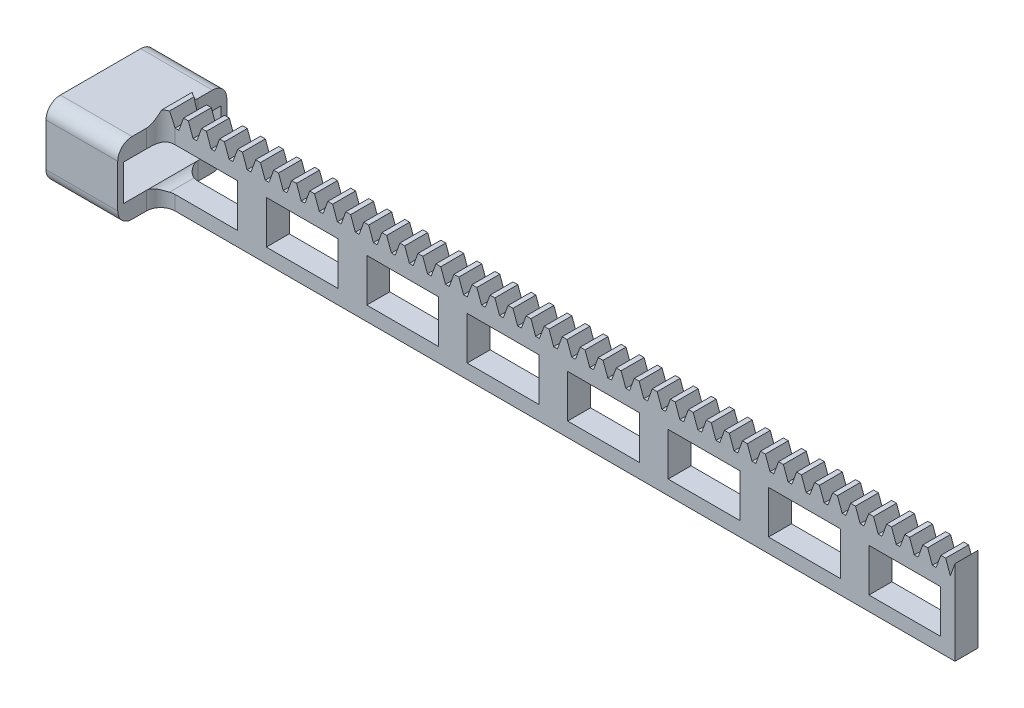
from build123d import *

# Parameters (mm, degrees)
SKETCH_1_W             = 125.663706144
SKETCH_1_H             = 10
EXTRUDE_1_DEPTH        = 30
EXTRUDE_2_DEPTH        = 30
PATTERN_LINEAR_1_COUNT = 20
PATTERN_LINEAR_1_PITCH = 6.283185307
CUT_EXTRUDE_1_DEPTH    = 22
CUT_EXTRUDE_2_REACH    = 128.315
CUT_EXTRUDE_3_REACH    = 246.059
CUT_EXTRUDE_6_REACH    = 484.653
SKETCH_7_W             = 207.345115137
SKETCH_7_H             = 14.578468588
CUT_EXTRUDE_7_REACH    = 552.426
SKETCH_9_W             = 278.972656916
SKETCH_9_H             = 19.040254303
SKETCH_10_W            = 8
SKETCH_10_H            = 15
EXTRUDE_1_2_DEPTH      = 276.776278088
SKETCH_11_W            = 38
SKETCH_11_H            = 25
SKETCH_11_R            = 1.25
EXTRUDE_2_2_DEPTH      = 25
CUT_EXTRUDE_9_REACH    = 280.853
SKETCH_12_W            = 25
SKETCH_12_H            = 15
CUT_EXTRUDE_10_REACH   = 280.853
SKETCH_13_W            = 1.776278088
SKETCH_13_H            = 15
SKETCH_14_W            = 34
SKETCH_14_H            = 12.5
CUT_EXTRUDE_11_DEPTH   = 20
CUT_EXTRUDE_12_REACH   = 305.682
SKETCH_15_W            = 23.5
SKETCH_15_H            = 12.5
FILLET_1_R             = 5
FILLET_2_R             = 5


with BuildPart() as part:
    # 草图1 → Extrude 1 (new body)
    with BuildSketch(Plane.XY):
        with Locations((62.831853072, -5)):
            Rectangle(SKETCH_1_W, SKETCH_1_H)
    extrude(amount=EXTRUDE_1_DEPTH)

    # 草图2 → Extrude 2 (add)
    with BuildSketch(Plane.XY.offset(30)):
        Polygon((0, 0), (1.637866054, 4.5), (3.323577771, 4.5), (4.961443825, 0), align=None)
    extrude_2 = extrude(amount=-EXTRUDE_2_DEPTH)

    # 阵列(线性)1: Extrude 2 ×20
    with Locations(*[(i * PATTERN_LINEAR_1_PITCH, 0, 0) for i in range(1, PATTERN_LINEAR_1_COUNT)]):
        add(extrude_2)

    # 草图3 → 切除-拉伸1 (cut)
    with BuildSketch(Plane.XY.offset(30)):
        Polygon((0, 0), (0, -10), (125.663706144, -10), (125.663706144, 0), (124.341964661, 0), (122.704098607, 4.5), (121.018386891, 4.5), (119.380520836, 0), (118.058779354, 0), (116.4209133, 4.5), (114.735201583, 4.5), (113.097335529, 0), (111.775594047, 0), (110.137727993, 4.5), (108.452016276, 4.5), (106.814150222, 0), (105.49240874, 0), (103.854542686, 4.5), (102.168830969, 4.5), (100.530964915, 0), (99.209223433, 0), (97.571357378, 4.5), (95.885645662, 4.5), (94.247779608, 0), (92.926038125, 0), (91.288172071, 4.5), (89.602460355, 4.5), (87.964594301, 0), (86.642852818, 0), (85.004986764, 4.5), (83.319275048, 4.5), (81.681408993, 0), (80.359667511, 0), (78.721801457, 4.5), (77.03608974, 4.5), (75.398223686, 0), (74.076482204, 0), (72.43861615, 4.5), (70.752904433, 4.5), (69.115038379, 0), (67.793296897, 0), (66.155430843, 4.5), (64.469719126, 4.5), (62.831853072, 0), (61.51011159, 0), (59.872245535, 4.5), (58.186533819, 4.5), (56.548667765, 0), (55.226926282, 0), (53.589060228, 4.5), (51.903348512, 4.5), (50.265482457, 0), (48.943740975, 0), (47.305874921, 4.5), (45.620163204, 4.5), (43.98229715, 0), (42.660555668, 0), (41.022689614, 4.5), (39.336977897, 4.5), (37.699111843, 0), (36.377370361, 0), (34.739504307, 4.5), (33.05379259, 4.5), (31.415926536, 0), (30.094185054, 0), (28.456318999, 4.5), (26.770607283, 4.5), (25.132741229, 0), (23.810999746, 0), (22.173133692, 4.5), (20.487421976, 4.5), (18.849555922, 0), (17.527814439, 0), (15.889948385, 4.5), (14.204236669, 4.5), (12.566370614, 0), (11.244629132, 0), (9.606763078, 4.5), (7.921051361, 4.5), (6.283185307, 0), (4.961443825, 0), (3.323577771, 4.5), (1.637866054, 4.5), align=None)
    extrude(amount=-CUT_EXTRUDE_1_DEPTH, mode=Mode.SUBTRACT)

    # 草图4 → 切除-拉伸2 (cut, up to next)
    with BuildSketch(Plane(origin=(0, 0, 0), x_dir=(-1, 0, 0), z_dir=(0, 0, -1)), mode=Mode.PRIVATE) as cut_extrude_2_sk1:
        Polygon((-121.861242749, 4.5), (-121.861242749, -10), (-125.663706144, -10), (-125.663706144, 0), (-124.341964661, 0), (-122.704098607, 4.5), align=None)
    cut_extrude_2_tool1 = extrude(cut_extrude_2_sk1.sketch, amount=-CUT_EXTRUDE_2_REACH, mode=Mode.PRIVATE) & part.part
    add(cut_extrude_2_tool1.solids().sort_by_distance((123.597626, -3.869254, 0))[0], mode=Mode.SUBTRACT)

    # 镜向1: part across plane


with BuildPart() as part_1:
    add(part.part)
    add(part.part.mirror(Plane(origin=(121.861242749, 4.5, 8.001025), x_dir=(0, 0, 1), z_dir=(-1, 0, 0))))

    # 草图5 → 切除-拉伸3 (cut, up to next)
    with BuildSketch(Plane(origin=(0, 0, 0), x_dir=(-1, 0, 0), z_dir=(0, 0, -1)), mode=Mode.PRIVATE) as cut_extrude_3_sk1:
        Polygon((-241.241763585, 4.5), (-241.241763585, -10), (-243.722485498, -10), (-243.722485498, 0), (-242.084619444, 4.5), align=None)
    cut_extrude_3_tool1 = extrude(cut_extrude_3_sk1.sketch, amount=-CUT_EXTRUDE_3_REACH, mode=Mode.PRIVATE) & part_1.part
    add(cut_extrude_3_tool1.solids().sort_by_distance((242.402862, -3.406333, 0))[0], mode=Mode.SUBTRACT)

    # 镜向2: part across plane


with BuildPart() as part_2:
    add(part_1.part)
    add(part_1.part.mirror(Plane(origin=(241.241763585, 4.5, 8.001025), x_dir=(0, 0, 1), z_dir=(-1, 0, 0))))

    # 草图7 → 切除-拉伸6 (cut, up to next)
    with BuildSketch(Plane(origin=(0, 0, 0), x_dir=(-1, 0, 0), z_dir=(0, 0, -1)), mode=Mode.PRIVATE) as cut_extrude_6_sk1:
        with Locations((-378.810969602, -2.710765706)):
            Rectangle(SKETCH_7_W, SKETCH_7_H)
    cut_extrude_6_tool1 = extrude(cut_extrude_6_sk1.sketch, amount=-CUT_EXTRUDE_6_REACH, mode=Mode.PRIVATE) & part_2.part
    add(cut_extrude_6_tool1.solids().sort_by_distance((378.81097, -2.710766, 0))[0], mode=Mode.SUBTRACT)

    # 镜向4: part across plane


with BuildPart() as part_3:
    add(part_2.part)
    add(part_2.part.mirror(Plane(origin=(275.138412034, 4.578468588, 8.001025), x_dir=(0, 0, 1), z_dir=(-1, 0, 0))))

    # 草图9 → 切除-拉伸7 (cut, up to next)
    with BuildSketch(Plane(origin=(0, 0, 0), x_dir=(-1, 0, 0), z_dir=(0, 0, -1)), mode=Mode.PRIVATE) as cut_extrude_7_sk1:
        with Locations((-416.262606546, -4.273704806)):
            Rectangle(SKETCH_9_W, SKETCH_9_H)
    cut_extrude_7_tool1 = extrude(cut_extrude_7_sk1.sketch, amount=-CUT_EXTRUDE_7_REACH, mode=Mode.PRIVATE) & part_3.part
    add(cut_extrude_7_tool1.solids().sort_by_distance((416.262607, -4.273705, 0))[0], mode=Mode.SUBTRACT)

    # 草图10 → Extrude 1 2 (add)
    with BuildSketch(Plane.ZY):
        with Locations((4, -17.5)):
            Rectangle(SKETCH_10_W, SKETCH_10_H)
    extrude(amount=-EXTRUDE_1_2_DEPTH)

    # 草图11 → Extrude 2 2 (add)
    with BuildSketch(Plane.ZY):
        with Locations((4, -12.5)):
            Rectangle(SKETCH_11_W, SKETCH_11_H)
        with Locations(Location((-10, -16, 0), (0, 0, 270))):
            Circle(SKETCH_11_R, mode=Mode.SUBTRACT)
        with Locations(Location((-10, -9, 0), (0, 0, 270))):
            Circle(SKETCH_11_R, mode=Mode.SUBTRACT)
        with Locations(Location((18, -9, 0), (0, 0, 270))):
            Circle(SKETCH_11_R, mode=Mode.SUBTRACT)
        with Locations(Location((18, -16, 0), (0, 0, 270))):
            Circle(SKETCH_11_R, mode=Mode.SUBTRACT)
    extrude(amount=EXTRUDE_2_2_DEPTH)

    # 草图12 → 切除-拉伸9 (cut, up to next)
    with BuildSketch(Plane(origin=(0, 0, 0), x_dir=(-1, 0, 0), z_dir=(0, 0, -1)), mode=Mode.PRIVATE) as cut_extrude_9_sk1:
        with Locations((-259.276278088, -12.5)):
            Rectangle(SKETCH_12_W, SKETCH_12_H)
    cut_extrude_9_tool1 = extrude(cut_extrude_9_sk1.sketch, amount=-CUT_EXTRUDE_9_REACH, mode=Mode.PRIVATE) & part_3.part
    # 草图12 → 切除-拉伸9 (cut, up to next)
    with BuildSketch(Plane(origin=(0, 0, 0), x_dir=(-1, 0, 0), z_dir=(0, 0, -1)), mode=Mode.PRIVATE) as cut_extrude_9_sk2:
        with Locations((-224.276278088, -12.5)):
            Rectangle(SKETCH_12_W, SKETCH_12_H)
    cut_extrude_9_tool2 = extrude(cut_extrude_9_sk2.sketch, amount=-CUT_EXTRUDE_9_REACH, mode=Mode.PRIVATE) & part_3.part
    # 草图12 → 切除-拉伸9 (cut, up to next)
    with BuildSketch(Plane(origin=(0, 0, 0), x_dir=(-1, 0, 0), z_dir=(0, 0, -1)), mode=Mode.PRIVATE) as cut_extrude_9_sk3:
        with Locations((-189.276278088, -12.5)):
            Rectangle(SKETCH_12_W, SKETCH_12_H)
    cut_extrude_9_tool3 = extrude(cut_extrude_9_sk3.sketch, amount=-CUT_EXTRUDE_9_REACH, mode=Mode.PRIVATE) & part_3.part
    # 草图12 → 切除-拉伸9 (cut, up to next)
    with BuildSketch(Plane(origin=(0, 0, 0), x_dir=(-1, 0, 0), z_dir=(0, 0, -1)), mode=Mode.PRIVATE) as cut_extrude_9_sk4:
        with Locations((-154.276278088, -12.5)):
            Rectangle(SKETCH_12_W, SKETCH_12_H)
    cut_extrude_9_tool4 = extrude(cut_extrude_9_sk4.sketch, amount=-CUT_EXTRUDE_9_REACH, mode=Mode.PRIVATE) & part_3.part
    # 草图12 → 切除-拉伸9 (cut, up to next)
    with BuildSketch(Plane(origin=(0, 0, 0), x_dir=(-1, 0, 0), z_dir=(0, 0, -1)), mode=Mode.PRIVATE) as cut_extrude_9_sk5:
        with Locations((-119.276278088, -12.5)):
            Rectangle(SKETCH_12_W, SKETCH_12_H)
    cut_extrude_9_tool5 = extrude(cut_extrude_9_sk5.sketch, amount=-CUT_EXTRUDE_9_REACH, mode=Mode.PRIVATE) & part_3.part
    # 草图12 → 切除-拉伸9 (cut, up to next)
    with BuildSketch(Plane(origin=(0, 0, 0), x_dir=(-1, 0, 0), z_dir=(0, 0, -1)), mode=Mode.PRIVATE) as cut_extrude_9_sk6:
        with Locations((-84.276278088, -12.5)):
            Rectangle(SKETCH_12_W, SKETCH_12_H)
    cut_extrude_9_tool6 = extrude(cut_extrude_9_sk6.sketch, amount=-CUT_EXTRUDE_9_REACH, mode=Mode.PRIVATE) & part_3.part
    # 草图12 → 切除-拉伸9 (cut, up to next)
    with BuildSketch(Plane(origin=(0, 0, 0), x_dir=(-1, 0, 0), z_dir=(0, 0, -1)), mode=Mode.PRIVATE) as cut_extrude_9_sk7:
        with Locations((-49.276278088, -12.5)):
            Rectangle(SKETCH_12_W, SKETCH_12_H)
    cut_extrude_9_tool7 = extrude(cut_extrude_9_sk7.sketch, amount=-CUT_EXTRUDE_9_REACH, mode=Mode.PRIVATE) & part_3.part
    # 草图12 → 切除-拉伸9 (cut, up to next)
    with BuildSketch(Plane(origin=(0, 0, 0), x_dir=(-1, 0, 0), z_dir=(0, 0, -1)), mode=Mode.PRIVATE) as cut_extrude_9_sk8:
        with Locations((-14.276278088, -12.5)):
            Rectangle(SKETCH_12_W, SKETCH_12_H)
    cut_extrude_9_tool8 = extrude(cut_extrude_9_sk8.sketch, amount=-CUT_EXTRUDE_9_REACH, mode=Mode.PRIVATE) & part_3.part
    add(cut_extrude_9_tool1.solids().sort_by_distance((259.276278, -12.5, 0))[0], mode=Mode.SUBTRACT)
    add(cut_extrude_9_tool2.solids().sort_by_distance((224.276278, -12.5, 0))[0], mode=Mode.SUBTRACT)
    add(cut_extrude_9_tool3.solids().sort_by_distance((189.276278, -12.5, 0))[0], mode=Mode.SUBTRACT)
    add(cut_extrude_9_tool4.solids().sort_by_distance((154.276278, -12.5, 0))[0], mode=Mode.SUBTRACT)
    add(cut_extrude_9_tool5.solids().sort_by_distance((119.276278, -12.5, 0))[0], mode=Mode.SUBTRACT)
    add(cut_extrude_9_tool6.solids().sort_by_distance((84.276278, -12.5, 0))[0], mode=Mode.SUBTRACT)
    add(cut_extrude_9_tool7.solids().sort_by_distance((49.276278, -12.5, 0))[0], mode=Mode.SUBTRACT)
    add(cut_extrude_9_tool8.solids().sort_by_distance((14.276278, -12.5, 0))[0], mode=Mode.SUBTRACT)

    # 草图13 → 切除-拉伸10 (cut, up to next)
    with BuildSketch(Plane(origin=(0, 0, 0), x_dir=(-1, 0, 0), z_dir=(0, 0, -1)), mode=Mode.PRIVATE) as cut_extrude_10_sk1:
        with Locations((-0.888139044, -12.5)):
            Rectangle(SKETCH_13_W, SKETCH_13_H)
    cut_extrude_10_tool1 = extrude(cut_extrude_10_sk1.sketch, amount=-CUT_EXTRUDE_10_REACH, mode=Mode.PRIVATE) & part_3.part
    add(cut_extrude_10_tool1.solids().sort_by_distance((0.888139, -12.5, 0))[0], mode=Mode.SUBTRACT)

    # 草图14 → 切除-拉伸11 (cut)
    with BuildSketch(Plane(origin=(0, 0, 0), x_dir=(0, 0, -1), z_dir=(1, 0, 0))):
        with Locations((-4, -12.5)):
            Rectangle(SKETCH_14_W, SKETCH_14_H)
    extrude(amount=-CUT_EXTRUDE_11_DEPTH, mode=Mode.SUBTRACT)

    # 草图15 → 切除-拉伸12 (cut, up to next)
    with BuildSketch(Plane.ZY.offset(25), mode=Mode.PRIVATE) as cut_extrude_12_sk1:
        with Locations((4, -12.5)):
            Rectangle(SKETCH_15_W, SKETCH_15_H)
    cut_extrude_12_tool1 = extrude(cut_extrude_12_sk1.sketch, amount=-CUT_EXTRUDE_12_REACH, mode=Mode.PRIVATE) & part_3.part
    add(cut_extrude_12_tool1.solids().sort_by_distance((-25, -12.5, 4))[0], mode=Mode.SUBTRACT)

    # 圆角1
    fillet_1_edges = [part_3.edges().sort_by_distance(p)[0] for p in [
        (-12.5, 0, -15),
        (-12.5, -25, -15),
        (-12.5, -25, 23),
        (-12.5, 0, 23),
    ]]
    fillet(fillet_1_edges, radius=FILLET_1_R)

    # 圆角2
    # the kernel refuses this fillet: 5 mm, written as the material it adds along each edge
    with BuildSketch(Plane(origin=(0, -25, 0), x_dir=(0, 0, -1), z_dir=(0, 1, 0)), Plane(origin=(0, -20, 8), x_dir=(0, 0, 1), z_dir=(0, -1, 0))) as fillet_2_piece_1:
        with BuildLine():
            CenterArc((FILLET_2_R, -FILLET_2_R), FILLET_2_R, 90, 90)
            Line((0, -FILLET_2_R), (-FILLET_2_R * 0.02, -FILLET_2_R))
            Line((-FILLET_2_R * 0.02, -FILLET_2_R), (-FILLET_2_R * 0.02, FILLET_2_R * 0.02))
            Line((-FILLET_2_R * 0.02, FILLET_2_R * 0.02), (FILLET_2_R, FILLET_2_R * 0.02))
            Line((FILLET_2_R, FILLET_2_R * 0.02), (FILLET_2_R, 0))
        make_face()
    extrude(amount=5)
    with BuildSketch(Plane(origin=(0, -20, 0), x_dir=(0, 1, 0), z_dir=(0, 0, 1))) as fillet_2_piece_2:
        with BuildLine():
            CenterArc((5, -3.307189139), FILLET_2_R, 138.590377891, 41.409622109)
            Line((0, -3.307189139), (-0.1, -3.307189139))
            Line((-0.1, -3.307189139), (-0.1, 0))
            Line((-0.1, 0), (0, 0.1))
            ThreePointArc((0, 0.1), (0.625, 0.1), (1.175, 0.066143783))
            Line((1.175, 0.066143783), (1.25, 0))
        make_face()
    extrude(amount=8)
    with BuildSketch(Plane(origin=(0, -5, 0), x_dir=(0, 0, -1), z_dir=(0, 1, 0))) as fillet_2_piece_3_section:
        with BuildLine():
            CenterArc((FILLET_2_R, -FILLET_2_R), FILLET_2_R, 90, 90)
            Line((0, -FILLET_2_R), (-FILLET_2_R * 0.02, -FILLET_2_R))
            Line((-FILLET_2_R * 0.02, -FILLET_2_R), (-FILLET_2_R * 0.02, FILLET_2_R * 0.02))
            Line((-FILLET_2_R * 0.02, FILLET_2_R * 0.02), (FILLET_2_R, FILLET_2_R * 0.02))
            Line((FILLET_2_R, FILLET_2_R * 0.02), (FILLET_2_R, 0))
        make_face()
    fillet_2_piece_3 = extrude(amount=5, mode=Mode.PRIVATE)
    fillet_2_piece_3 = split(fillet_2_piece_3, bisect_by=Plane(origin=(-0.672472736, -1.847603657, -1.129079789), z_dir=(0.9396926207859086, -0.3420201433256681, 0)), keep=Keep.TOP, mode=Mode.PRIVATE)
    add(fillet_2_piece_3)
    with BuildSketch(Plane(origin=(0, -5, 0), x_dir=(0, 0, -1), z_dir=(0, 1, 0))) as fillet_2_piece_4_section:
        with BuildLine():
            CenterArc((FILLET_2_R, -FILLET_2_R), FILLET_2_R, 90, 90)
            Line((0, -FILLET_2_R), (-FILLET_2_R * 0.02, -FILLET_2_R))
            Line((-FILLET_2_R * 0.02, -FILLET_2_R), (-FILLET_2_R * 0.02, FILLET_2_R * 0.02))
            Line((-FILLET_2_R * 0.02, FILLET_2_R * 0.02), (FILLET_2_R, FILLET_2_R * 0.02))
            Line((FILLET_2_R, FILLET_2_R * 0.02), (FILLET_2_R, 0))
        make_face()
    fillet_2_piece_4 = extrude(amount=5, mode=Mode.PRIVATE)
    fillet_2_piece_4 = split(fillet_2_piece_4, bisect_by=Plane(origin=(4.975797866, -0.039437404, 0.049987607), z_dir=(0.9396926207859082, 0.3420201433256694, 0)), keep=Keep.TOP, mode=Mode.PRIVATE)
    add(fillet_2_piece_4)
    with BuildSketch(Plane(origin=(0, -5, 0), x_dir=(0, 0, -1), z_dir=(0, 1, 0))) as fillet_2_piece_5_section:
        with BuildLine():
            CenterArc((FILLET_2_R, -FILLET_2_R), FILLET_2_R, 90, 90)
            Line((0, -FILLET_2_R), (-FILLET_2_R * 0.02, -FILLET_2_R))
            Line((-FILLET_2_R * 0.02, -FILLET_2_R), (-FILLET_2_R * 0.02, FILLET_2_R * 0.02))
            Line((-FILLET_2_R * 0.02, FILLET_2_R * 0.02), (FILLET_2_R, FILLET_2_R * 0.02))
            Line((FILLET_2_R, FILLET_2_R * 0.02), (FILLET_2_R, 0))
        make_face()
    fillet_2_piece_5 = extrude(amount=17.5, mode=Mode.PRIVATE)
    fillet_2_piece_5 = split(fillet_2_piece_5, bisect_by=Plane(origin=(1.714960856, 0, -0.674876137), z_dir=(0, 1, 0)), keep=Keep.TOP, mode=Mode.PRIVATE)
    fillet_2_piece_5 = split(fillet_2_piece_5, bisect_by=Plane(origin=(0.764024617, 2.099140384, -0.674876137), z_dir=(0.9396926207859086, -0.3420201433256681, 0)), keep=Keep.TOP, mode=Mode.PRIVATE)
    fillet_2_piece_5 = split(fillet_2_piece_5, bisect_by=Plane(origin=(1.714960856, 4.5, -0.674876137), z_dir=(0, -1, 0)), keep=Keep.TOP, mode=Mode.PRIVATE)
    fillet_2_piece_5 = split(fillet_2_piece_5, bisect_by=Plane(origin=(4.018265153, 2.591362103, -0.674876137), z_dir=(-0.9396926207859082, -0.3420201433256694, 0)), keep=Keep.TOP, mode=Mode.PRIVATE)
    add(fillet_2_piece_5)
    with BuildSketch(Plane(origin=(0, -5, 0), x_dir=(0, 0, -1), z_dir=(0, 1, 0))) as fillet_2_piece_6_section:
        with BuildLine():
            CenterArc((FILLET_2_R, -FILLET_2_R), FILLET_2_R, 90, 90)
            Line((0, -FILLET_2_R), (-FILLET_2_R * 0.02, -FILLET_2_R))
            Line((-FILLET_2_R * 0.02, -FILLET_2_R), (-FILLET_2_R * 0.02, FILLET_2_R * 0.02))
            Line((-FILLET_2_R * 0.02, FILLET_2_R * 0.02), (FILLET_2_R, FILLET_2_R * 0.02))
            Line((FILLET_2_R, FILLET_2_R * 0.02), (FILLET_2_R, 0))
        make_face()
    fillet_2_piece_6 = extrude(amount=5, mode=Mode.PRIVATE)
    fillet_2_piece_6 = split(fillet_2_piece_6, bisect_by=Plane(origin=(-0.037232593, -0.102295707, -2.45), z_dir=(-0.9396926207859086, 0.3420201433256681, 0)), keep=Keep.TOP, mode=Mode.PRIVATE)
    add(fillet_2_piece_6)
    with BuildSketch(Plane(origin=(0, 12.5, 8), x_dir=(0, 0, 1), z_dir=(0, -1, 0))) as fillet_2_piece_7_section:
        with BuildLine():
            CenterArc((FILLET_2_R, -FILLET_2_R), FILLET_2_R, 90, 90)
            Line((0, -FILLET_2_R), (-FILLET_2_R * 0.02, -FILLET_2_R))
            Line((-FILLET_2_R * 0.02, -FILLET_2_R), (-FILLET_2_R * 0.02, FILLET_2_R * 0.02))
            Line((-FILLET_2_R * 0.02, FILLET_2_R * 0.02), (FILLET_2_R, FILLET_2_R * 0.02))
            Line((FILLET_2_R, FILLET_2_R * 0.02), (FILLET_2_R, 0))
        make_face()
    fillet_2_piece_7 = extrude(amount=17.5, mode=Mode.PRIVATE)
    fillet_2_piece_7 = split(fillet_2_piece_7, bisect_by=Plane(origin=(1.714960856, 0, 8.674876137), z_dir=(0, 1, 0)), keep=Keep.TOP, mode=Mode.PRIVATE)
    fillet_2_piece_7 = split(fillet_2_piece_7, bisect_by=Plane(origin=(0.764024617, 2.099140384, 8.674876137), z_dir=(0.9396926207859086, -0.3420201433256681, 0)), keep=Keep.TOP, mode=Mode.PRIVATE)
    fillet_2_piece_7 = split(fillet_2_piece_7, bisect_by=Plane(origin=(4.018265153, 2.591362103, 8.674876137), z_dir=(-0.9396926207859082, -0.3420201433256694, 0)), keep=Keep.TOP, mode=Mode.PRIVATE)
    fillet_2_piece_7 = split(fillet_2_piece_7, bisect_by=Plane(origin=(1.714960856, 4.5, 8.674876137), z_dir=(0, -1, 0)), keep=Keep.TOP, mode=Mode.PRIVATE)
    add(fillet_2_piece_7)
    with BuildSketch(Plane(origin=(0, 0, 8), x_dir=(0, 0, 1), z_dir=(0, -1, 0))) as fillet_2_piece_8_section:
        with BuildLine():
            CenterArc((FILLET_2_R, -FILLET_2_R), FILLET_2_R, 90, 90)
            Line((0, -FILLET_2_R), (-FILLET_2_R * 0.02, -FILLET_2_R))
            Line((-FILLET_2_R * 0.02, -FILLET_2_R), (-FILLET_2_R * 0.02, FILLET_2_R * 0.02))
            Line((-FILLET_2_R * 0.02, FILLET_2_R * 0.02), (FILLET_2_R, FILLET_2_R * 0.02))
            Line((FILLET_2_R, FILLET_2_R * 0.02), (FILLET_2_R, 0))
        make_face()
    fillet_2_piece_8 = extrude(amount=5, mode=Mode.PRIVATE)
    fillet_2_piece_8 = split(fillet_2_piece_8, bisect_by=Plane(origin=(-0.672472736, -1.847603657, 9.129079789), z_dir=(0.9396926207859086, -0.3420201433256681, 0)), keep=Keep.TOP, mode=Mode.PRIVATE)
    add(fillet_2_piece_8)
    with BuildSketch(Plane(origin=(0, 0, 8), x_dir=(0, 0, 1), z_dir=(0, -1, 0))) as fillet_2_piece_9_section:
        with BuildLine():
            CenterArc((FILLET_2_R, -FILLET_2_R), FILLET_2_R, 90, 90)
            Line((0, -FILLET_2_R), (-FILLET_2_R * 0.02, -FILLET_2_R))
            Line((-FILLET_2_R * 0.02, -FILLET_2_R), (-FILLET_2_R * 0.02, FILLET_2_R * 0.02))
            Line((-FILLET_2_R * 0.02, FILLET_2_R * 0.02), (FILLET_2_R, FILLET_2_R * 0.02))
            Line((FILLET_2_R, FILLET_2_R * 0.02), (FILLET_2_R, 0))
        make_face()
    fillet_2_piece_9 = extrude(amount=5, mode=Mode.PRIVATE)
    fillet_2_piece_9 = split(fillet_2_piece_9, bisect_by=Plane(origin=(-0.037232593, -0.102295707, 10.45), z_dir=(-0.9396926207859086, 0.3420201433256681, 0)), keep=Keep.TOP, mode=Mode.PRIVATE)
    add(fillet_2_piece_9)
    with BuildSketch(Plane(origin=(0, 0, 8), x_dir=(0, 0, 1), z_dir=(0, -1, 0))) as fillet_2_piece_10_section:
        with BuildLine():
            CenterArc((FILLET_2_R, -FILLET_2_R), FILLET_2_R, 90, 90)
            Line((0, -FILLET_2_R), (-FILLET_2_R * 0.02, -FILLET_2_R))
            Line((-FILLET_2_R * 0.02, -FILLET_2_R), (-FILLET_2_R * 0.02, FILLET_2_R * 0.02))
            Line((-FILLET_2_R * 0.02, FILLET_2_R * 0.02), (FILLET_2_R, FILLET_2_R * 0.02))
            Line((FILLET_2_R, FILLET_2_R * 0.02), (FILLET_2_R, 0))
        make_face()
    fillet_2_piece_10 = extrude(amount=5, mode=Mode.PRIVATE)
    fillet_2_piece_10 = split(fillet_2_piece_10, bisect_by=Plane(origin=(4.975797866, -0.039437404, 7.950012393), z_dir=(0.9396926207859082, 0.3420201433256694, 0)), keep=Keep.TOP, mode=Mode.PRIVATE)
    add(fillet_2_piece_10)
    with BuildSketch(Plane(origin=(0, -5, 0), x_dir=(0, -1, 0), z_dir=(0, 0, 1))) as fillet_2_piece_11:
        with BuildLine():
            CenterArc((5, 3.307189139), FILLET_2_R, 180, 41.409622109)
            Line((0, 3.307189139), (-0.1, 3.307189139))
            Line((-0.1, 3.307189139), (-0.1, 0))
            Line((-0.1, 0), (0, -0.1))
            ThreePointArc((0, -0.1), (0.625, -0.1), (1.175, -0.066143783))
            Line((1.175, -0.066143783), (1.25, 0))
        make_face()
    extrude(amount=8)
    with BuildSketch(Plane(origin=(0, -25, 0), x_dir=(0, 0, -1), z_dir=(0, 1, 0))) as fillet_2_piece_12a_section:
        with BuildLine():
            CenterArc((FILLET_2_R, -FILLET_2_R), FILLET_2_R, 90, 90)
            Line((0, -FILLET_2_R), (-FILLET_2_R * 0.02, -FILLET_2_R))
            Line((-FILLET_2_R * 0.02, -FILLET_2_R), (-FILLET_2_R * 0.02, FILLET_2_R * 0.02))
            Line((-FILLET_2_R * 0.02, FILLET_2_R * 0.02), (FILLET_2_R, FILLET_2_R * 0.02))
            Line((FILLET_2_R, FILLET_2_R * 0.02), (FILLET_2_R, 0))
        make_face()
    fillet_2_piece_12a = extrude(amount=17.5, mode=Mode.PRIVATE)
    fillet_2_piece_12a = split(fillet_2_piece_12a, bisect_by=Plane(origin=(1.131975571, -18.75, -1.131975571), z_dir=(0, -1, 0)), keep=Keep.TOP, mode=Mode.PRIVATE)
    fillet_2_piece_12a = split(fillet_2_piece_12a, bisect_by=Plane(origin=(1.131975571, -20, -1.131975571), z_dir=(0, 1, 0)), keep=Keep.TOP, mode=Mode.PRIVATE)
    with BuildSketch(Plane(origin=(0, -20, -8.267972847), x_dir=(0, 1, 0), z_dir=(0, 0, 1))) as fillet_2_piece_12b_section:
        with BuildLine():
            CenterArc((5, -3.307189139), FILLET_2_R, 138.590377891, 41.409622109)
            Line((0, -3.307189139), (-0.1, -3.307189139))
            Line((-0.1, -3.307189139), (-0.1, 0))
            Line((-0.1, 0), (0, 0.1))
            ThreePointArc((0, 0.1), (0.625, 0.1), (1.175, 0.066143783))
            Line((1.175, 0.066143783), (1.25, 0))
        make_face()
    fillet_2_piece_12b = extrude(amount=16.267972847, mode=Mode.PRIVATE)
    fillet_2_piece_12b = split(fillet_2_piece_12b, bisect_by=Plane(origin=(0.907037832, -19.701125048, 0), z_dir=(0, 0, -1)), keep=Keep.TOP, mode=Mode.PRIVATE)
    fillet_2_piece_12 = fillet_2_piece_12a & fillet_2_piece_12b
    add(fillet_2_piece_12)
    with BuildSketch(Plane(origin=(0, -20, 0), x_dir=(0, 1, 0), z_dir=(0, 0, 1))) as fillet_2_piece_13a_section:
        with BuildLine():
            CenterArc((5, -3.307189139), FILLET_2_R, 138.590377891, 41.409622109)
            Line((0, -3.307189139), (-0.1, -3.307189139))
            Line((-0.1, -3.307189139), (-0.1, 0))
            Line((-0.1, 0), (0, 0.1))
            ThreePointArc((0, 0.1), (0.625, 0.1), (1.175, 0.066143783))
            Line((1.175, 0.066143783), (1.25, 0))
        make_face()
    fillet_2_piece_13a = extrude(amount=16.267972847, mode=Mode.PRIVATE)
    fillet_2_piece_13a = split(fillet_2_piece_13a, bisect_by=Plane(origin=(0.907037832, -19.701125048, 8), z_dir=(0, 0, 1)), keep=Keep.TOP, mode=Mode.PRIVATE)
    with BuildSketch(Plane(origin=(0, -7.5, 8), x_dir=(0, 0, 1), z_dir=(0, -1, 0))) as fillet_2_piece_13b_section:
        with BuildLine():
            CenterArc((FILLET_2_R, -FILLET_2_R), FILLET_2_R, 90, 90)
            Line((0, -FILLET_2_R), (-FILLET_2_R * 0.02, -FILLET_2_R))
            Line((-FILLET_2_R * 0.02, -FILLET_2_R), (-FILLET_2_R * 0.02, FILLET_2_R * 0.02))
            Line((-FILLET_2_R * 0.02, FILLET_2_R * 0.02), (FILLET_2_R, FILLET_2_R * 0.02))
            Line((FILLET_2_R, FILLET_2_R * 0.02), (FILLET_2_R, 0))
        make_face()
    fillet_2_piece_13b = extrude(amount=17.5, mode=Mode.PRIVATE)
    fillet_2_piece_13b = split(fillet_2_piece_13b, bisect_by=Plane(origin=(1.131975571, -18.75, 9.131975571), z_dir=(0, -1, 0)), keep=Keep.TOP, mode=Mode.PRIVATE)
    fillet_2_piece_13b = split(fillet_2_piece_13b, bisect_by=Plane(origin=(1.131975571, -20, 9.131975571), z_dir=(0, 1, 0)), keep=Keep.TOP, mode=Mode.PRIVATE)
    fillet_2_piece_13 = fillet_2_piece_13a & fillet_2_piece_13b
    add(fillet_2_piece_13)
    with BuildSketch(Plane(origin=(0, -17.5, 0), x_dir=(0, 0, -1), z_dir=(0, 1, 0))) as fillet_2_piece_14a_section:
        with BuildLine():
            CenterArc((FILLET_2_R, -FILLET_2_R), FILLET_2_R, 90, 90)
            Line((0, -FILLET_2_R), (-FILLET_2_R * 0.02, -FILLET_2_R))
            Line((-FILLET_2_R * 0.02, -FILLET_2_R), (-FILLET_2_R * 0.02, FILLET_2_R * 0.02))
            Line((-FILLET_2_R * 0.02, FILLET_2_R * 0.02), (FILLET_2_R, FILLET_2_R * 0.02))
            Line((FILLET_2_R, FILLET_2_R * 0.02), (FILLET_2_R, 0))
        make_face()
    fillet_2_piece_14a = extrude(amount=17.5, mode=Mode.PRIVATE)
    fillet_2_piece_14a = split(fillet_2_piece_14a, bisect_by=Plane(origin=(1.131975571, -6.25, -1.131975571), z_dir=(0, 1, 0)), keep=Keep.TOP, mode=Mode.PRIVATE)
    fillet_2_piece_14a = split(fillet_2_piece_14a, bisect_by=Plane(origin=(1.131975571, -5, -1.131975571), z_dir=(0, -1, 0)), keep=Keep.TOP, mode=Mode.PRIVATE)
    with BuildSketch(Plane(origin=(0, -5, -8.267972847), x_dir=(0, -1, 0), z_dir=(0, 0, 1))) as fillet_2_piece_14b_section:
        with BuildLine():
            CenterArc((5, 3.307189139), FILLET_2_R, 180, 41.409622109)
            Line((0, 3.307189139), (-0.1, 3.307189139))
            Line((-0.1, 3.307189139), (-0.1, 0))
            Line((-0.1, 0), (0, -0.1))
            ThreePointArc((0, -0.1), (0.625, -0.1), (1.175, -0.066143783))
            Line((1.175, -0.066143783), (1.25, 0))
        make_face()
    fillet_2_piece_14b = extrude(amount=16.267972847, mode=Mode.PRIVATE)
    fillet_2_piece_14b = split(fillet_2_piece_14b, bisect_by=Plane(origin=(0.907037832, -5.298874952, 0), z_dir=(0, 0, -1)), keep=Keep.TOP, mode=Mode.PRIVATE)
    fillet_2_piece_14 = fillet_2_piece_14a & fillet_2_piece_14b
    add(fillet_2_piece_14)
    with BuildSketch(Plane(origin=(0, -5, 0), x_dir=(0, -1, 0), z_dir=(0, 0, 1))) as fillet_2_piece_15a_section:
        with BuildLine():
            CenterArc((5, 3.307189139), FILLET_2_R, 180, 41.409622109)
            Line((0, 3.307189139), (-0.1, 3.307189139))
            Line((-0.1, 3.307189139), (-0.1, 0))
            Line((-0.1, 0), (0, -0.1))
            ThreePointArc((0, -0.1), (0.625, -0.1), (1.175, -0.066143783))
            Line((1.175, -0.066143783), (1.25, 0))
        make_face()
    fillet_2_piece_15a = extrude(amount=16.267972847, mode=Mode.PRIVATE)
    fillet_2_piece_15a = split(fillet_2_piece_15a, bisect_by=Plane(origin=(0.907037832, -5.298874952, 8), z_dir=(0, 0, 1)), keep=Keep.TOP, mode=Mode.PRIVATE)
    with BuildSketch(Plane(origin=(0, 0, 8), x_dir=(0, 0, 1), z_dir=(0, -1, 0))) as fillet_2_piece_15b_section:
        with BuildLine():
            CenterArc((FILLET_2_R, -FILLET_2_R), FILLET_2_R, 90, 90)
            Line((0, -FILLET_2_R), (-FILLET_2_R * 0.02, -FILLET_2_R))
            Line((-FILLET_2_R * 0.02, -FILLET_2_R), (-FILLET_2_R * 0.02, FILLET_2_R * 0.02))
            Line((-FILLET_2_R * 0.02, FILLET_2_R * 0.02), (FILLET_2_R, FILLET_2_R * 0.02))
            Line((FILLET_2_R, FILLET_2_R * 0.02), (FILLET_2_R, 0))
        make_face()
    fillet_2_piece_15b = extrude(amount=17.5, mode=Mode.PRIVATE)
    fillet_2_piece_15b = split(fillet_2_piece_15b, bisect_by=Plane(origin=(1.131975571, -6.25, 9.131975571), z_dir=(0, 1, 0)), keep=Keep.TOP, mode=Mode.PRIVATE)
    fillet_2_piece_15b = split(fillet_2_piece_15b, bisect_by=Plane(origin=(1.131975571, -5, 9.131975571), z_dir=(0, -1, 0)), keep=Keep.TOP, mode=Mode.PRIVATE)
    fillet_2_piece_15 = fillet_2_piece_15a & fillet_2_piece_15b
    add(fillet_2_piece_15)


solid = part_3.part
